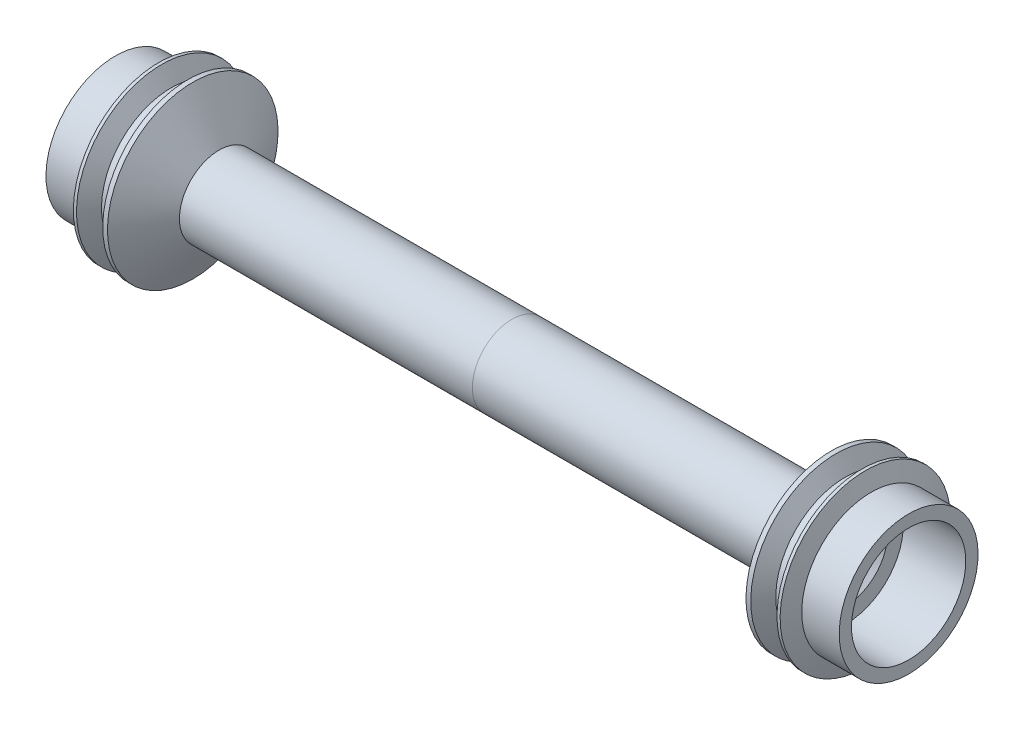
from build123d import *

# Parameters (mm, degrees)
CHAMFER1_SIZE = 0.508


with BuildPart() as part:
    # Sketch2 → Revolve1 (revolve)
    with BuildSketch(Plane.XY):
        Polygon((-28.75, 5.55625), (-31.75, 5.55625), (-31.75, 4.575), (-26.75, 4.575), (-26.75, 3.305), (-26.242, 2.797), (-26.242, 1.7145), (-21.925, 1.7145), (-21.925, 0), (-14.1, 0), (-12.5, 1.6), (0, 1.6), (0, 3.175), (-23.447714988, 3.175), (-25.555765158, 6.82625), (-25.936765158, 6.82625), (-26.67, 5.55625), (-27.305, 5.55625), (-28.038234842, 6.82625), (-28.287757802, 6.82625), align=None)
    revolve(axis=Axis((-31.75, 0, 0), (1, 0, 0)))


with BuildPart() as body_2:
    # Mirror1: mirrored copy
    add(part.part.mirror(Plane(origin=(0, 0, 0), x_dir=(0, 0, 1), z_dir=(1, 0, 0))))


with BuildPart() as part_1:
    add(part.part)

    # Chamfer1
    chamfer1_edges = [part_1.edges().sort_by_distance(p)[0] for p in [
        (-31.75, -4.575, 0),
    ]]
    chamfer(chamfer1_edges, length=CHAMFER1_SIZE)


solid = Compound([body_2.part, part_1.part])
